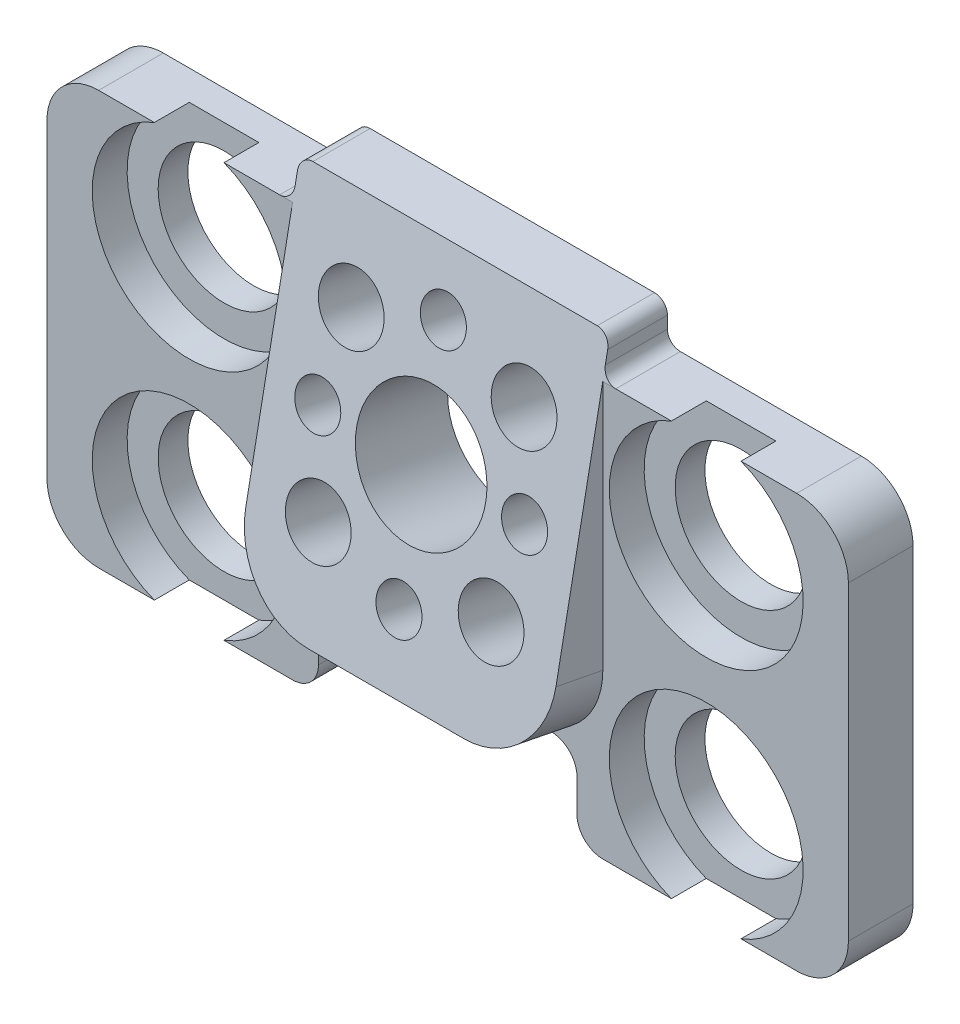
from build123d import *

# Parameters (mm, degrees)
SKETCH1_R           = 5.1
BOSS_EXTRUDE1_DEPTH = 5
CUT_EXTRUDE1_START  = -2.3
SKETCH2_R           = 7.5
CUT_EXTRUDE1_DEPTH  = 33.942020373
BOSS_EXTRUDE2_DEPTH = 12
SKETCH4_R           = 5
SKETCH4_R_2         = 1.75
SKETCH4_R_3         = 2.5
CUT_EXTRUDE2_DEPTH  = 37.455291152
FILLET1_R           = 1
SKETCH5_W           = 20
SKETCH5_H           = 6.532082626
CUT_EXTRUDE3_DEPTH  = 37.672994655
FILLET2_R           = 2
FILLET3_R           = 6


with BuildPart() as part:
    # Sketch1 → Boss-Extrude1 (new body)
    with BuildSketch(Plane.XY):
        with BuildLine():
            Line((-27, -16), (27, -16))
            ThreePointArc((27, -16), (29.828427125, -14.828427125), (31, -12))
            Line((31, -12), (31, 12))
            ThreePointArc((31, 12), (29.828427125, 14.828427125), (27, 16))
            Line((27, 16), (-27, 16))
            ThreePointArc((-27, 16), (-29.828427125, 14.828427125), (-31, 12))
            Line((-31, 12), (-31, -12))
            ThreePointArc((-31, -12), (-29.828427125, -14.828427125), (-27, -16))
        make_face()
        with Locations((-20, 9)):
            Circle(SKETCH1_R, mode=Mode.SUBTRACT)
        with Locations((20, -9)):
            Circle(SKETCH1_R, mode=Mode.SUBTRACT)
        with Locations((-20, -9)):
            Circle(SKETCH1_R, mode=Mode.SUBTRACT)
        with Locations((20, 9)):
            Circle(SKETCH1_R, mode=Mode.SUBTRACT)
    extrude(amount=BOSS_EXTRUDE1_DEPTH)

    # Sketch2 → Cut-Extrude1 (cut, through all)
    with BuildSketch(Plane(origin=(0, 0, 0), x_dir=(-1, 0, 0), z_dir=(0, 0, -1)).offset(CUT_EXTRUDE1_START)):
        with Locations((20, 9)):
            Circle(SKETCH2_R)
        with Locations((-20, 9)):
            Circle(SKETCH2_R)
        with Locations((-20, -9)):
            Circle(SKETCH2_R)
        with Locations((20, -9)):
            Circle(SKETCH2_R)
    extrude(amount=-CUT_EXTRUDE1_DEPTH, mode=Mode.SUBTRACT)

    # Sketch3 → Boss-Extrude2 (add, symmetric)
    with BuildSketch(Plane(origin=(0, 0, 0), x_dir=(0, 0, -1), z_dir=(1, 0, 0))):
        Polygon((-5, 16), (-9.770224884, -8.540679586), (-5, -9.467917374), align=None)
        Polygon((0, 16), (-5, 16), (-4.427573014, 18.94488155), (0, 18.94488155), align=None)
    extrude(amount=BOSS_EXTRUDE2_DEPTH, both=True)

    # Sketch4 → Cut-Extrude2 (cut, through all)
    with BuildSketch(Plane(origin=(0, 1.519045647, 7.814812384), x_dir=(1, 0, 0), z_dir=(0, 0.19080899537654522, 0.981627183447664))):
        with Locations(Location((0, 4, 0), (0, 0, 270))):
            Circle(SKETCH4_R)
        with Locations(Location((0, 13, 0), (0, 0, 270))):
            Circle(SKETCH4_R_2)
        with Locations(Location((8, 4, 0), (0, 0, 270))):
            Circle(SKETCH4_R_2)
        with Locations(Location((0, -5, 0), (0, 0, 270))):
            Circle(SKETCH4_R_2)
        with Locations(Location((-8, 4, 0), (0, 0, 270))):
            Circle(SKETCH4_R_2)
        with Locations(Location((-6.686187475, -2.686187475, 0), (0, 0, 270))):
            Circle(SKETCH4_R_3)
        with Locations(Location((6.686187475, -2.686187475, 0), (0, 0, 90))):
            Circle(SKETCH4_R_3)
        with Locations(Location((6.686187475, 10.686187475, 0), (0, 0, 270))):
            Circle(SKETCH4_R_3)
        with Locations(Location((-6.686187475, 10.686187475, 0), (0, 0, 90))):
            Circle(SKETCH4_R_3)
    extrude(amount=-CUT_EXTRUDE2_DEPTH, mode=Mode.SUBTRACT)

    # Fillet1
    # the kernel refuses this fillet: 1 mm, written as the material it adds along each edge
    with BuildSketch(Plane(origin=(12, 16, 0), x_dir=(1, 0, 0), z_dir=(0, 0, 1))) as fillet1_piece_1_section:
        with BuildLine():
            CenterArc((FILLET1_R, FILLET1_R), FILLET1_R, 180, 90)
            Line((0, FILLET1_R), (0, 0))
            Line((0, 0), (FILLET1_R, 0))
        make_face()
    fillet1_piece_1 = extrude(amount=5, mode=Mode.PRIVATE)
    fillet1_piece_1 = split(fillet1_piece_1, bisect_by=Plane(origin=(12.227463764, 16.688764384, 4.866117766), z_dir=(0, -0.19080899537654517, -0.981627183447664)), keep=Keep.TOP, mode=Mode.PRIVATE)
    add(fillet1_piece_1)
    with BuildSketch(Plane(origin=(-12, 16, 0), x_dir=(-1, 0, 0), z_dir=(0, 0, 1))) as fillet1_piece_2_section:
        with BuildLine():
            CenterArc((FILLET1_R, -FILLET1_R), FILLET1_R, 90, 90)
            Line((0, -FILLET1_R), (0, 0))
            Line((0, 0), (FILLET1_R, 0))
        make_face()
    fillet1_piece_2 = extrude(amount=5, mode=Mode.PRIVATE)
    fillet1_piece_2 = split(fillet1_piece_2, bisect_by=Plane(origin=(-12.227463764, 16.688764384, 4.866117766), z_dir=(0, -0.19080899537654517, -0.981627183447664)), keep=Keep.TOP, mode=Mode.PRIVATE)
    add(fillet1_piece_2)
    # the kernel refuses this fillet: 1 mm, written as the material it takes off along each edge
    with BuildSketch(Plane(origin=(12, 18.94488155, 6.927573014), x_dir=(0, -1, 0), z_dir=(0, 0, -1))) as fillet1_2_piece_1:
        with BuildLine():
            CenterArc((FILLET1_R, FILLET1_R), FILLET1_R, 180, 90)
            Line((0, FILLET1_R), (0, 0))
            Line((0, 0), (FILLET1_R, 0))
        make_face()
    extrude(amount=9.427573014, mode=Mode.SUBTRACT)
    with BuildSketch(Plane(origin=(-12, 18.94488155, 6.927573014), x_dir=(0, -1, 0), z_dir=(0, 0, -1))) as fillet1_2_piece_2:
        with BuildLine():
            CenterArc((FILLET1_R, -FILLET1_R), FILLET1_R, 90, 90)
            Line((0, -FILLET1_R), (0, 0))
            Line((0, 0), (FILLET1_R, 0))
        make_face()
    extrude(amount=9.427573014, mode=Mode.SUBTRACT)

    # Sketch5 → Cut-Extrude3 (cut, through all)
    with BuildSketch(Plane.XY.offset(5)):
        with Locations((0, -12.733958687)):
            Rectangle(SKETCH5_W, SKETCH5_H)
    extrude(amount=-CUT_EXTRUDE3_DEPTH, mode=Mode.SUBTRACT)

    # Fillet2
    fillet2_edges = [part.edges().sort_by_distance(p)[0] for p in [
        (-10, -16, 2.5),
        (-10, -9.467917374, 2.5),
        (10, -9.467917374, 2.5),
        (10, -16, 2.5),
    ]]
    fillet(fillet2_edges, radius=FILLET2_R)

    # Fillet3
    # the kernel refuses this fillet: 6 mm, written as the material it takes off along each edge
    with BuildSketch(Plane(origin=(-12, -5.678544656, 24.494632636), x_dir=(1, 0, 0), z_dir=(0, -0.19080899537654505, -0.981627183447664))) as fillet3_piece_1_section:
        with BuildLine():
            CenterArc((FILLET3_R, -FILLET3_R), FILLET3_R, 90, 90)
            Line((0, -FILLET3_R), (0, 0))
            Line((0, 0), (FILLET3_R, 0))
        make_face()
    fillet3_piece_1 = extrude(amount=34.859507728, mode=Mode.PRIVATE)
    fillet3_piece_1 = split(fillet3_piece_1, bisect_by=Plane(origin=(-10.628321285, -7.717365946, 5), z_dir=(0, 0, 1)), keep=Keep.TOP, mode=Mode.PRIVATE)
    add(fillet3_piece_1, mode=Mode.SUBTRACT)
    with BuildSketch(Plane(origin=(12, -5.678544656, 24.494632636), x_dir=(-1, 0, 0), z_dir=(0, -0.19080899537654505, -0.981627183447664))) as fillet3_piece_2_section:
        with BuildLine():
            CenterArc((FILLET3_R, FILLET3_R), FILLET3_R, 180, 90)
            Line((0, FILLET3_R), (0, 0))
            Line((0, 0), (FILLET3_R, 0))
        make_face()
    fillet3_piece_2 = extrude(amount=34.859507728, mode=Mode.PRIVATE)
    fillet3_piece_2 = split(fillet3_piece_2, bisect_by=Plane(origin=(10.628321285, -7.717365946, 5), z_dir=(0, 0, 1)), keep=Keep.TOP, mode=Mode.PRIVATE)
    add(fillet3_piece_2, mode=Mode.SUBTRACT)


solid = part.part
